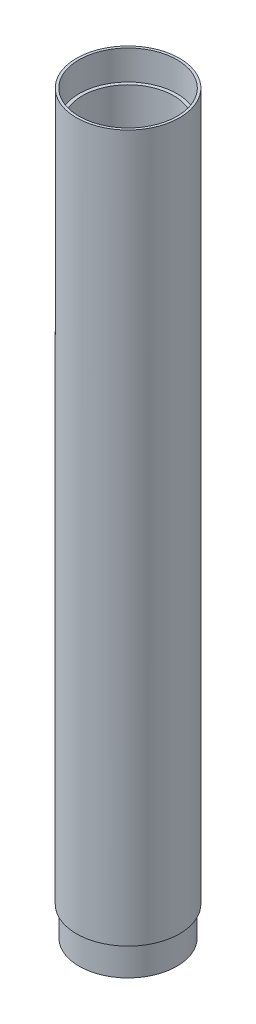
from build123d import *

# Parameters (mm, degrees)
SKETCH1_R           = 17.5
SKETCH1_R_2         = 15.5
BOSS_EXTRUDE1_DEPTH = 240
SKETCH2_R           = 17.5
SKETCH2_R_2         = 16.65
BOSS_EXTRUDE2_DEPTH = 10
SKETCH3_R           = 17.5
SKETCH3_R_2         = 16.6
CUT_EXTRUDE1_DEPTH  = 10


with BuildPart() as part:
    # Sketch1 → Boss-Extrude1 (new body)
    with BuildSketch(Plane(origin=(0, 0, 0), x_dir=(1, 0, 0), z_dir=(0, 1, 0))):
        Circle(SKETCH1_R)
        Circle(SKETCH1_R_2, mode=Mode.SUBTRACT)
    extrude(amount=BOSS_EXTRUDE1_DEPTH)

    # Sketch2 → Boss-Extrude2 (add)
    with BuildSketch(Plane(origin=(0, 240, 0), x_dir=(1, 0, 0), z_dir=(0, 1, 0))):
        Circle(SKETCH2_R)
        Circle(SKETCH2_R_2, mode=Mode.SUBTRACT)
    extrude(amount=BOSS_EXTRUDE2_DEPTH)

    # Sketch3 → Cut-Extrude1 (cut)
    with BuildSketch(Plane.XZ):
        Circle(SKETCH3_R)
        Circle(SKETCH3_R_2, mode=Mode.SUBTRACT)
    extrude(amount=-CUT_EXTRUDE1_DEPTH, mode=Mode.SUBTRACT)


solid = part.part
